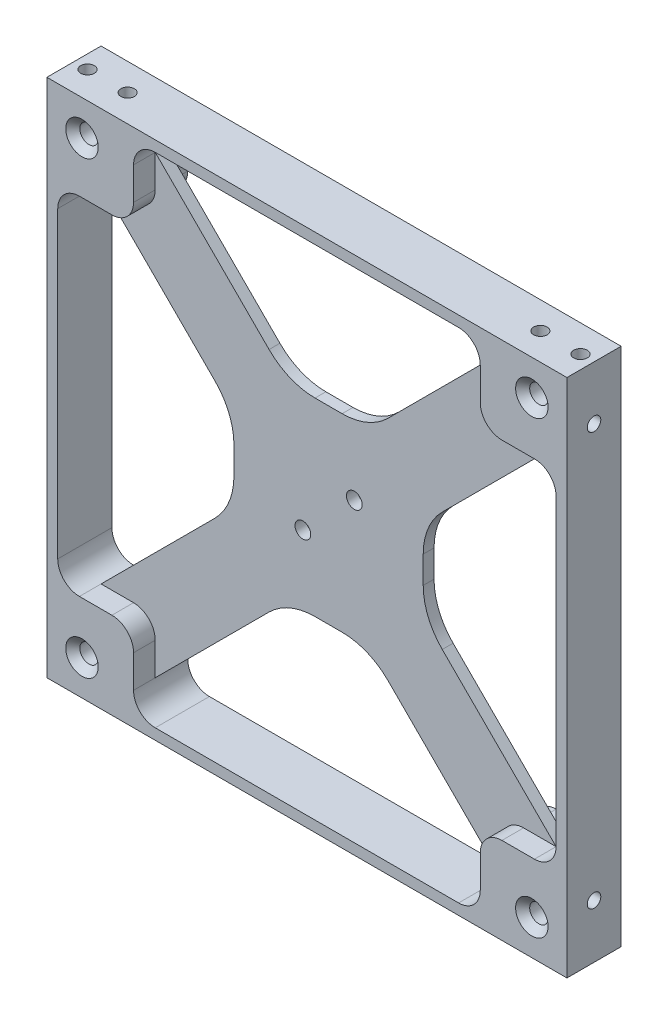
from build123d import *

# Parameters (mm, degrees)
BOTTOMLAYER_DEPTH              = 4
MIDDLELAYER_DEPTH              = 2
FILLUPLAYER_START              = -2
FILLUPLAYER_DEPTH              = 2
TOPLAYER_DEPTH                 = 4
M3_CLEARANCE_HOLE1_D           = 3.4
M3_CLEARANCE_HOLE1_CSINK_D     = 6
M3_CLEARANCE_HOLE1_CSINK_ANGLE = 90
M2_5_CLEARANCE_HOLE1_D         = 2.9
CIRPATTERN1_COUNT              = 4


with BuildPart() as part:
    # Sketch3 → BottomLayer (new body)
    with BuildSketch(Plane.XY):
        with BuildLine():
            Line((0, 48), (48, 48))
            Line((48, 48), (48, 0))
            Line((48, 0), (46, 0))
            Line((46, 0), (46, 28))
            ThreePointArc((46, 28), (44.828427125, 30.828427125), (42, 32))
            Line((42, 32), (36, 32))
            ThreePointArc((36, 32), (33.171572875, 33.171572875), (32, 36))
            Line((32, 36), (32, 42))
            ThreePointArc((32, 42), (30.828427125, 44.828427125), (28, 46))
            Line((28, 46), (0, 46))
            Line((0, 46), (0, 48))
        make_face()
    bottomlayer = extrude(amount=BOTTOMLAYER_DEPTH)

    # Sketch6 → MiddleLayer (add)
    with BuildSketch(Plane.XY.offset(4)):
        with BuildLine():
            Line((0, 17.470562748), (0, 0))
            Line((0, 0), (17.470562748, 0))
            Line((17.470562748, 0), (17.470562748, 2.5))
            ThreePointArc((17.470562748, 2.5), (18.384008358, 7.092201188), (20.985281374, 10.985281374))
            Line((20.985281374, 10.985281374), (48, 38))
            Line((48, 38), (48, 48))
            Line((48, 48), (38, 48))
            Line((38, 48), (10.985281374, 20.985281374))
            ThreePointArc((10.985281374, 20.985281374), (7.092201188, 18.384008358), (2.5, 17.470562748))
            Line((2.5, 17.470562748), (0, 17.470562748))
        make_face()
    middlelayer = extrude(amount=MIDDLELAYER_DEPTH)

    # Sketch10 → FillUpLayer (add)
    with BuildSketch(Plane.XY.offset(6).offset(FILLUPLAYER_START)):
        with BuildLine():
            Line((48, 48), (0, 48))
            Line((0, 48), (0, 46))
            Line((0, 46), (28, 46))
            ThreePointArc((28, 46), (30.828427125, 44.828427125), (32, 42))
            Line((32, 42), (32, 36))
            ThreePointArc((32, 36), (33.171572875, 33.171572875), (36, 32))
            Line((36, 32), (42, 32))
            ThreePointArc((42, 32), (44.828427125, 30.828427125), (46, 28))
            Line((46, 28), (46, 0))
            Line((46, 0), (48, 0))
            Line((48, 0), (48, 48))
        make_face()
    filluplayer = extrude(amount=FILLUPLAYER_DEPTH)

    # Sketch11 → TopLayer (add)
    with BuildSketch(Plane.XY.offset(6)):
        with BuildLine():
            Line((48, 48), (0, 48))
            Line((0, 48), (0, 46))
            Line((0, 46), (28, 46))
            ThreePointArc((28, 46), (30.828427125, 44.828427125), (32, 42))
            Line((32, 42), (32, 36))
            ThreePointArc((32, 36), (33.171572875, 33.171572875), (36, 32))
            Line((36, 32), (42, 32))
            ThreePointArc((42, 32), (44.828427125, 30.828427125), (46, 28))
            Line((46, 28), (46, 0))
            Line((46, 0), (48, 0))
            Line((48, 0), (48, 48))
        make_face()
    toplayer = extrude(amount=TOPLAYER_DEPTH)

    # M3 Clearance Hole1 (through all)
    with Locations(Plane.XY.offset(10)):
        with Locations((41.525, 41.525)):
            m3_clearance_hole1 = CounterSinkHole(M3_CLEARANCE_HOLE1_D / 2, M3_CLEARANCE_HOLE1_CSINK_D / 2, counter_sink_angle=M3_CLEARANCE_HOLE1_CSINK_ANGLE)

    # M2.5 Clearance Hole1 (through all)
    with Locations(Plane.XY.offset(6)):
        with Locations((4.75, 4.75)):
            m2_5_clearance_hole1 = Hole(M2_5_CLEARANCE_HOLE1_D / 2)

    # CirPattern1: BottomLayer, MiddleLayer, FillUpLayer, TopLayer, M3 Clearance Hole1 ×4 about axis
    cirpattern1_axis = Axis((0, 0, -0.5), (0, 0, 1))
    add([bottomlayer.rotate(cirpattern1_axis, i * 360 / CIRPATTERN1_COUNT) for i in range(1, CIRPATTERN1_COUNT)])
    add([middlelayer.rotate(cirpattern1_axis, i * 360 / CIRPATTERN1_COUNT) for i in range(1, CIRPATTERN1_COUNT)])
    add([filluplayer.rotate(cirpattern1_axis, i * 360 / CIRPATTERN1_COUNT) for i in range(1, CIRPATTERN1_COUNT)])
    add([toplayer.rotate(cirpattern1_axis, i * 360 / CIRPATTERN1_COUNT) for i in range(1, CIRPATTERN1_COUNT)])
    add([m3_clearance_hole1.rotate(cirpattern1_axis, i * 360 / CIRPATTERN1_COUNT) for i in range(1, CIRPATTERN1_COUNT)], mode=Mode.SUBTRACT)

    # Sketch21 → Tap Drill M3 Side Plate (revolve, cut)
    with BuildSketch(Plane(origin=(48, 38.1, 5), x_dir=(0, 0, -1), z_dir=(0, 1, 0))):
        Polygon((0, 0), (0, 5.751075774), (1.25, 5), (1.25, 0), align=None)
    tap_drill_m3_side_plate = revolve(axis=Axis((54.35, 38.1, 5), (-1, 0, 0)), mode=Mode.SUBTRACT)

    # Camera Holes: M2.5 Clearance Hole1 across plane
    add(m2_5_clearance_hole1.mirror(Plane(origin=(0, 0, 0), x_dir=(0, 0, 1), z_dir=(-0.7071067811865476, -0.7071067811865476, 0))), mode=Mode.SUBTRACT)

    # Sketch27 → Tap Drill M3 Side Plate 2 (revolve, cut)
    with BuildSketch(Plane(origin=(38.1, 48, 5), x_dir=(0, 0, 1), z_dir=(1, 0, 0))):
        Polygon((0, 0), (0, 5.751075774), (1.25, 5), (1.25, 0), align=None)
    tap_drill_m3_side_plate_2 = revolve(axis=Axis((38.1, 54.35, 5), (0, -1, 0)), mode=Mode.SUBTRACT)

    # Sketch29 → Tap Drill M3 Rail (revolve, cut)
    with BuildSketch(Plane(origin=(45.5, 48, 5), x_dir=(0, 0, 1), z_dir=(1, 0, 0))):
        Polygon((0, 0), (0, 5.751075774), (1.25, 5), (1.25, 0), align=None)
    tap_drill_m3_rail = revolve(axis=Axis((45.5, 54.35, 5), (0, -1, 0)), mode=Mode.SUBTRACT)

    # SidePlate and Rail Holes 1: Tap Drill M3 Side Plate, Tap Drill M3 Side Plate 2, Tap Drill M3 Rail across plane
    add(tap_drill_m3_side_plate.mirror(Plane(origin=(0, 0, 0), x_dir=(0, 0, 1), z_dir=(1, 0, 0))), mode=Mode.SUBTRACT)
    add(tap_drill_m3_side_plate_2.mirror(Plane(origin=(0, 0, 0), x_dir=(0, 0, 1), z_dir=(1, 0, 0))), mode=Mode.SUBTRACT)
    add(tap_drill_m3_rail.mirror(Plane(origin=(0, 0, 0), x_dir=(0, 0, 1), z_dir=(1, 0, 0))), mode=Mode.SUBTRACT)

    # Side Plate and Rail Holes 2 copy 1 sketc → Side Plate and Rail Holes 2 copy 1 (revolve, cut)
    with BuildSketch(Plane(origin=(-48, -38.1, 5), x_dir=(0, 0, -1), z_dir=(0, -1, 0))):
        Polygon((0, 0), (0, 5.751075774), (1.25, 5), (1.25, 0), align=None)
    revolve(axis=Axis((-54.35, -38.1, 5), (1, 0, 0)), mode=Mode.SUBTRACT)

    # Side Plate and Rail Holes 2 copy 2 sketc → Side Plate and Rail Holes 2 copy 2 (revolve, cut)
    with BuildSketch(Plane(origin=(-38.1, -48, 5), x_dir=(0, 0, 1), z_dir=(-1, 0, 0))):
        Polygon((0, 0), (0, 5.751075774), (1.25, 5), (1.25, 0), align=None)
    revolve(axis=Axis((-38.1, -54.35, 5), (0, 1, 0)), mode=Mode.SUBTRACT)

    # Side Plate and Rail Holes 2 copy 3 sketc → Side Plate and Rail Holes 2 copy 3 (revolve, cut)
    with BuildSketch(Plane(origin=(-45.5, -48, 5), x_dir=(0, 0, 1), z_dir=(-1, 0, 0))):
        Polygon((0, 0), (0, 5.751075774), (1.25, 5), (1.25, 0), align=None)
    revolve(axis=Axis((-45.5, -54.35, 5), (0, 1, 0)), mode=Mode.SUBTRACT)

    # Side Plate and Rail Holes 2 copy 4 sketc → Side Plate and Rail Holes 2 copy 4 (revolve, cut)
    with BuildSketch(Plane(origin=(48, -38.1, 5), x_dir=(0, 0, -1), z_dir=(0, -1, 0))):
        Polygon((0, 0), (0, -5.751075774), (1.25, -5), (1.25, 0), align=None)
    revolve(axis=Axis((54.35, -38.1, 5), (1, 0, 0)), mode=Mode.SUBTRACT)

    # Side Plate and Rail Holes 2 copy 5 sketc → Side Plate and Rail Holes 2 copy 5 (revolve, cut)
    with BuildSketch(Plane(origin=(38.1, -48, 5), x_dir=(0, 0, 1), z_dir=(1, 0, 0))):
        Polygon((0, 0), (0, -5.751075774), (1.25, -5), (1.25, 0), align=None)
    revolve(axis=Axis((38.1, -54.35, 5), (0, -1, 0)), mode=Mode.SUBTRACT)

    # Side Plate and Rail Holes 2 copy 6 sketc → Side Plate and Rail Holes 2 copy 6 (revolve, cut)
    with BuildSketch(Plane(origin=(45.5, -48, 5), x_dir=(0, 0, 1), z_dir=(1, 0, 0))):
        Polygon((0, 0), (0, -5.751075774), (1.25, -5), (1.25, 0), align=None)
    revolve(axis=Axis((45.5, -54.35, 5), (0, -1, 0)), mode=Mode.SUBTRACT)


solid = part.part
